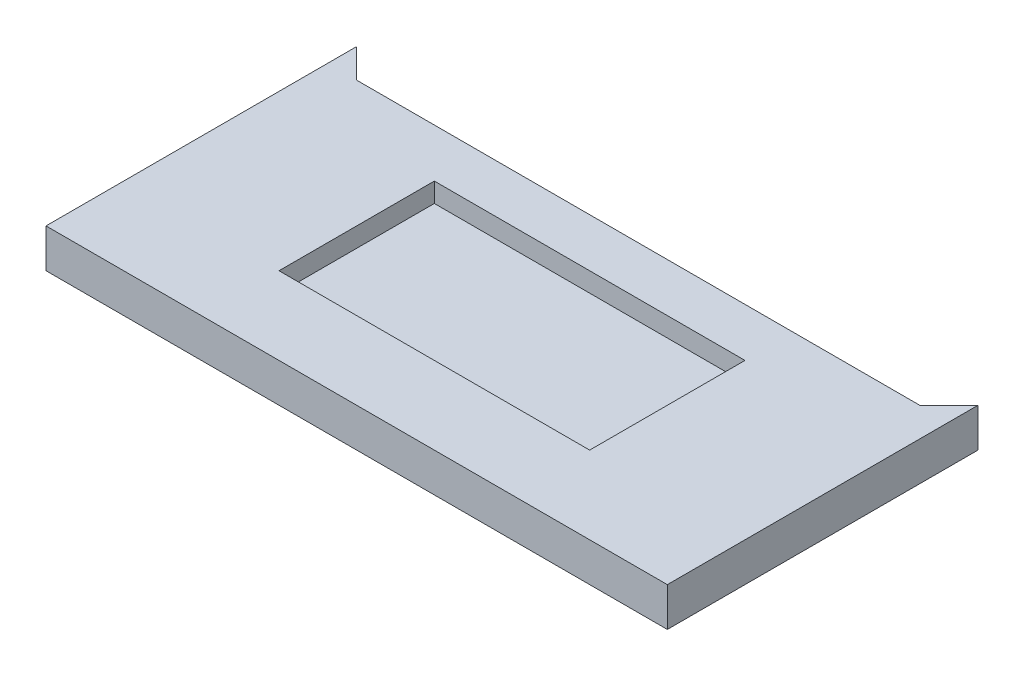
from build123d import *

# Parameters (mm, degrees)
SKETCH_1_W               = 320
SKETCH_1_H               = 160
EXTRUDE_1_DEPTH          = 20
SKETCH_2_W               = 160
SKETCH_2_H               = 80
CUT_EXTRUDE_1_DEPTH      = 10
CUT_EXTRUDE_2_DEPTH      = 181
CUT_EXTRUDE_2_DEPTH_BACK = 20


with BuildPart() as part:
    # Эскиз1 → Бобышка-Вытянуть1 (new body)
    with BuildSketch(Plane(origin=(0, 0, 0), x_dir=(1, 0, 0), z_dir=(0, 1, 0))):
        Rectangle(SKETCH_1_W, SKETCH_1_H)
    extrude(amount=EXTRUDE_1_DEPTH)

    # Эскиз2 → Вырез-Вытянуть1 (cut)
    with BuildSketch(Plane(origin=(0, 20, 0), x_dir=(1, 0, 0), z_dir=(0, 1, 0))):
        Rectangle(SKETCH_2_W, SKETCH_2_H)
    extrude(amount=-CUT_EXTRUDE_1_DEPTH, mode=Mode.SUBTRACT)

    # Эскиз3 → Вырез-Вытянуть2 (cut, two sides: drawn at the far end of the back side and taken through both)
    with BuildSketch(Plane(origin=(0, 20, 0), x_dir=(1, 0, 0), z_dir=(0, 1, 0)).offset(-CUT_EXTRUDE_2_DEPTH_BACK)):
        Polygon((-673.035493439, 593.035493439), (-160, 80), (-145, 65), (145, 65), (160, 80), (673.035493439, 593.035493439), (673.035493439, 2044.118999039), (-673.035493439, 2044.118999039), align=None)
    extrude(amount=CUT_EXTRUDE_2_DEPTH + CUT_EXTRUDE_2_DEPTH_BACK, mode=Mode.SUBTRACT)


solid = part.part
